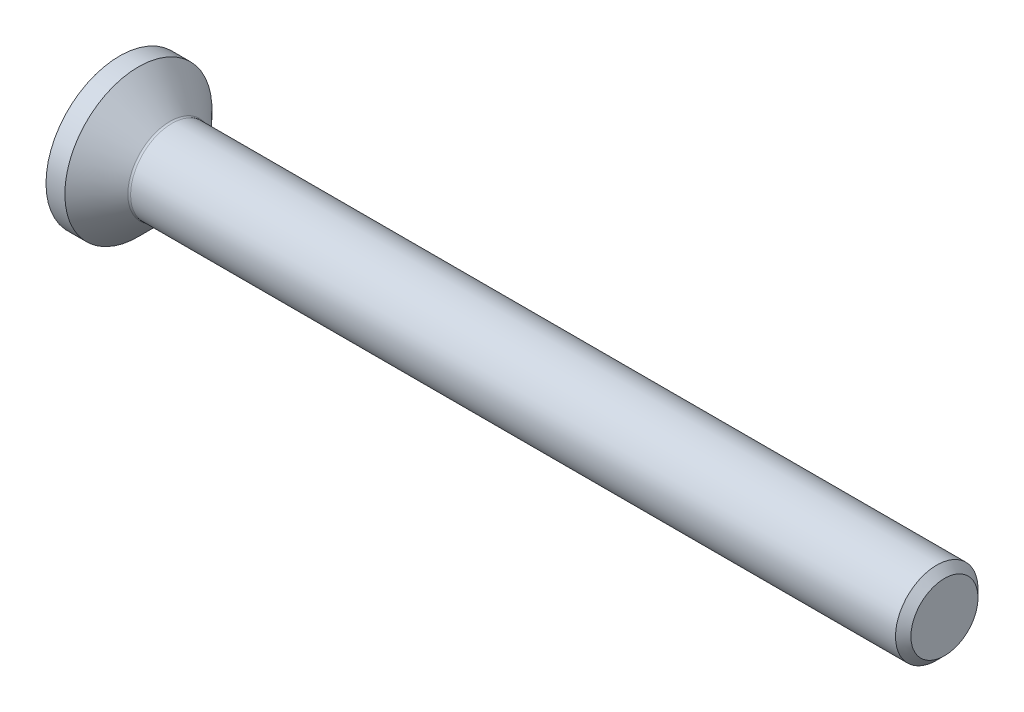
from build123d import *

# Parameters (mm, degrees)
FILLET1_R   = 0.1
HEX_START   = -1.1
HEX_2_DEPTH = 1.1


with BuildPart() as part:
    # BodySke → BaseBody (revolve)
    with BuildSketch(Plane.XY, mode=Mode.PRIVATE) as basebody_sk:
        Polygon((0, 0), (0, 2.675), (0.685, 2.675), (1.86, 1.5), (29.7195, 1.5), (30, 1.2195), (30, 0), align=None)
    revolve(basebody_sk.sketch.rotate(Axis((0, 0, 0), (1, 0, 0)), 90), axis=Axis((0, 0, 0), (1, 0, 0)))

    # Fillet1
    fillet1_edges = [part.edges().sort_by_distance(p)[0] for p in [
        (1.86, 0, -1.5),
    ]]
    fillet(fillet1_edges, radius=FILLET1_R)

    # Hex 2: read off the stored shape, not the designer's step
    # Hex 2 outline → Hex 2 (cut)
    with BuildSketch(Plane.ZY.offset(HEX_START)):
        Polygon((-1, -0.577350269), (0, -1.154700538), (1, -0.577350269), (1, 0.577350269), (0, 1.154700538), (-1, 0.577350269), align=None)
    extrude(amount=HEX_2_DEPTH, mode=Mode.SUBTRACT)

    # Hex 2 2 outline → Hex 2 2 (revolve, cut)
    with BuildSketch(Plane.YX):
        Polygon((1, 1.1), (0, 1.677350269), (0, 1.1), align=None)
    revolve(axis=Axis((0, 0, 0), (1, 0, 0)), mode=Mode.SUBTRACT)


solid = part.part
